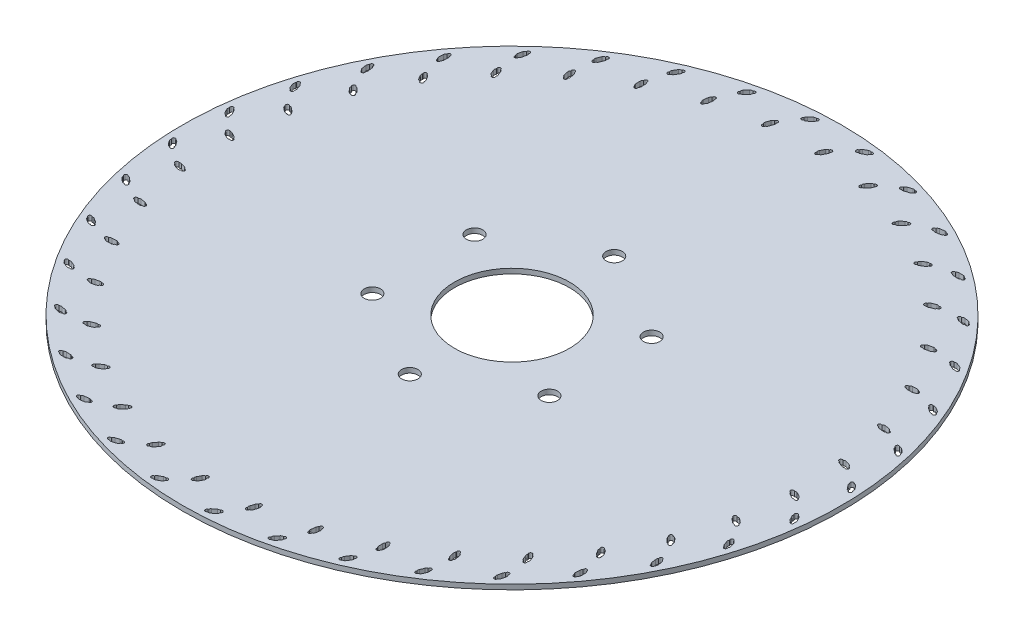
from build123d import *

# Parameters (mm, degrees)
SKETCH1_R          = 201.5
SKETCH1_R_2        = 35.15
SKETCH1_R_3        = 5
BASE_FLANGE1_DEPTH = 3
EXTRUDE1_DEPTH     = 10
CIRPATTERN1_COUNT  = 36


# Sheet-metal steps are written as plain solids
with BuildPart() as part:
    # Sketch1 → Base-Flange1 (new body)
    with BuildSketch(Plane(origin=(0, 0, 0), x_dir=(1, 0, 0), z_dir=(0, 1, 0))):
        with Locations(Location((0, 0, 0), (0, 0, 270))):
            Circle(SKETCH1_R)
        with Locations(Location((0, 0, 0), (0, 0, 270))):
            Circle(SKETCH1_R_2, mode=Mode.SUBTRACT)
        with Locations(Location((0, -62.5, 0), (0, 0, 270))):
            Circle(SKETCH1_R_3, mode=Mode.SUBTRACT)
        with Locations(Location((-54.126587737, -31.25, 0), (0, 0, 270))):
            Circle(SKETCH1_R_3, mode=Mode.SUBTRACT)
        with Locations(Location((-54.126587737, 31.25, 0), (0, 0, 270))):
            Circle(SKETCH1_R_3, mode=Mode.SUBTRACT)
        with Locations(Location((0, 62.5, 0), (0, 0, 270))):
            Circle(SKETCH1_R_3, mode=Mode.SUBTRACT)
        with Locations(Location((54.126587737, 31.25, 0), (0, 0, 270))):
            Circle(SKETCH1_R_3, mode=Mode.SUBTRACT)
        with Locations(Location((54.126587737, -31.25, 0), (0, 0, 270))):
            Circle(SKETCH1_R_3, mode=Mode.SUBTRACT)
    extrude(amount=-BASE_FLANGE1_DEPTH)

    # Sketch6 → Extrude1 (cut)
    with BuildSketch(Plane.XZ.offset(3)):
        with BuildLine():
            ThreePointArc((178.71439414, -21.58504291), (178.043718651, -21.955306594), (177.612549987, -22.588547774))
            ThreePointArc((177.612549987, -22.588547774), (176.53344221, -23.822359392), (178.062779342, -24.412183639))
            ThreePointArc((178.062779342, -24.412183639), (178.784151638, -24.783045054), (179.595079064, -24.765356427))
            ThreePointArc((179.595079064, -24.765356427), (180.955345353, -24.355853974), (182.296031452, -23.886197274))
            ThreePointArc((182.296031452, -23.886197274), (182.961997259, -23.423157618), (183.326853087, -22.69872929))
            ThreePointArc((183.326853087, -22.69872929), (184.215978762, -21.321696161), (182.617365105, -20.959482027))
            ThreePointArc((182.617365105, -20.959482027), (181.896061338, -20.701370261), (181.13593766, -20.796831256))
            ThreePointArc((181.13593766, -20.796831256), (179.933943226, -21.21790278), (178.71439414, -21.58504291))
        make_face()
        with BuildLine():
            ThreePointArc((192.446623859, -14.077843294), (192.450870848, -13.31176055), (192.800634566, -12.630169654))
            ThreePointArc((192.800634566, -12.630169654), (193.607537399, -11.644776502), (194.369769553, -10.624436366))
            ThreePointArc((194.369769553, -10.624436366), (194.947148797, -10.120914752), (195.689691943, -9.932419436))
            ThreePointArc((195.689691943, -9.932419436), (197.218243527, -9.340562393), (197.249235476, -10.97940473))
            ThreePointArc((197.249235476, -10.97940473), (197.350910408, -11.784127283), (197.056843948, -12.540064513))
            ThreePointArc((197.056843948, -12.540064513), (196.20666193, -13.678136202), (195.306654924, -14.777228565))
            ThreePointArc((195.306654924, -14.777228565), (194.643709947, -15.244582965), (193.838170501, -15.339569169))
            ThreePointArc((193.838170501, -15.339569169), (192.240039835, -15.703908406), (192.446623859, -14.077843294))
        make_face()
    extrude1 = extrude(amount=-EXTRUDE1_DEPTH, mode=Mode.SUBTRACT)

    # CirPattern1: Extrude1 ×36 about axis
    cirpattern1_axis = Axis((0, 0, 0), (0, 1, 0))
    for i in range(1, CIRPATTERN1_COUNT):
        add(extrude1.rotate(cirpattern1_axis, i * 360 / CIRPATTERN1_COUNT), mode=Mode.SUBTRACT)


solid = part.part
